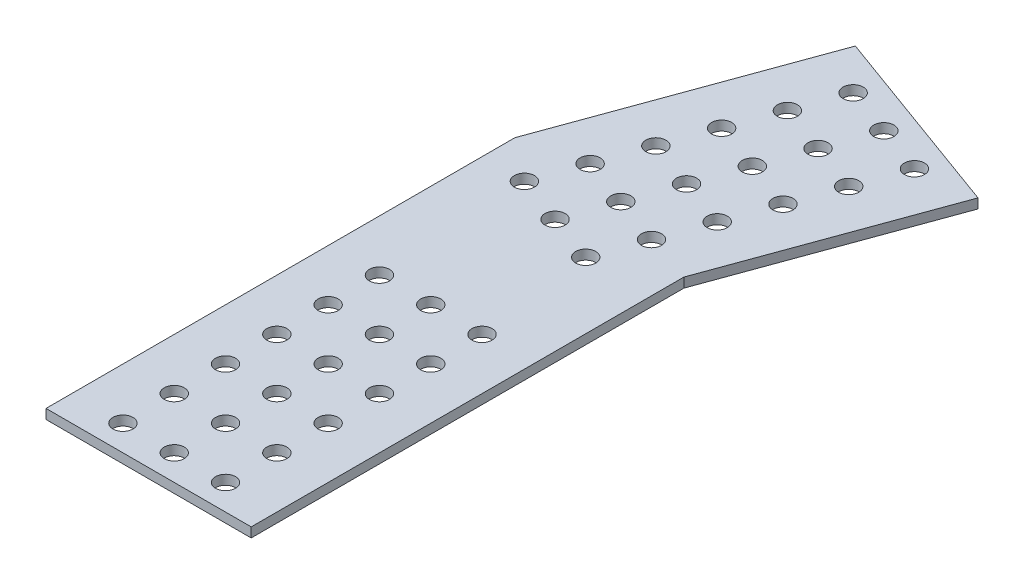
from build123d import *

# Parameters (mm, degrees)
SKETCH1_R           = 2.4892
BOSS_EXTRUDE1_DEPTH = 2.38125


with BuildPart() as part:
    # Sketch1 → Boss-Extrude1 (new body)
    with BuildSketch(Plane(origin=(0, 0, 0), x_dir=(1, 0, 0), z_dir=(0, 1, 0))):
        Polygon((-73.745518613, -384.005622456), (-73.745518613, -276.87877894), (-54.317612196, -223.501044752), (-102.053997332, -206.126421471), (-124.545518613, -267.92136832), (-124.545518613, -384.005622456), align=None)
        with Locations((-111.845518613, -377.655622456)):
            Circle(SKETCH1_R, mode=Mode.SUBTRACT)
        with Locations((-111.845518613, -364.955622456)):
            Circle(SKETCH1_R, mode=Mode.SUBTRACT)
        with Locations((-111.845518613, -352.255622456)):
            Circle(SKETCH1_R, mode=Mode.SUBTRACT)
        with Locations((-111.845518613, -339.555622456)):
            Circle(SKETCH1_R, mode=Mode.SUBTRACT)
        with Locations((-99.145518613, -377.655622456)):
            Circle(SKETCH1_R, mode=Mode.SUBTRACT)
        with Locations((-99.145518613, -364.955622456)):
            Circle(SKETCH1_R, mode=Mode.SUBTRACT)
        with Locations((-99.145518613, -352.255622456)):
            Circle(SKETCH1_R, mode=Mode.SUBTRACT)
        with Locations((-99.145518613, -339.555622456)):
            Circle(SKETCH1_R, mode=Mode.SUBTRACT)
        with Locations((-111.845518613, -326.855622456)):
            Circle(SKETCH1_R, mode=Mode.SUBTRACT)
        with Locations((-111.845518613, -314.155622456)):
            Circle(SKETCH1_R, mode=Mode.SUBTRACT)
        with Locations((-99.145518613, -326.855622456)):
            Circle(SKETCH1_R, mode=Mode.SUBTRACT)
        with Locations((-99.145518613, -314.155622456)):
            Circle(SKETCH1_R, mode=Mode.SUBTRACT)
        with Locations((-86.445518613, -377.655622456)):
            Circle(SKETCH1_R, mode=Mode.SUBTRACT)
        with Locations((-86.445518613, -364.955622456)):
            Circle(SKETCH1_R, mode=Mode.SUBTRACT)
        with Locations((-86.445518613, -352.255622456)):
            Circle(SKETCH1_R, mode=Mode.SUBTRACT)
        with Locations((-86.445518613, -339.555622456)):
            Circle(SKETCH1_R, mode=Mode.SUBTRACT)
        with Locations((-86.445518613, -326.855622456)):
            Circle(SKETCH1_R, mode=Mode.SUBTRACT)
        with Locations((-86.445518613, -314.155622456)):
            Circle(SKETCH1_R, mode=Mode.SUBTRACT)
        with Locations((-90.141815492, -284.794918494)):
            Circle(SKETCH1_R, mode=Mode.SUBTRACT)
        with Locations((-114.01000806, -276.107606853)):
            Circle(SKETCH1_R, mode=Mode.SUBTRACT)
        with Locations((-102.075911776, -280.451262674)):
            Circle(SKETCH1_R, mode=Mode.SUBTRACT)
        with Locations((-68.42353639, -225.124437074)):
            Circle(SKETCH1_R, mode=Mode.SUBTRACT)
        with Locations((-109.666352239, -264.173510569)):
            Circle(SKETCH1_R, mode=Mode.SUBTRACT)
        with Locations((-105.322696419, -252.239414285)):
            Circle(SKETCH1_R, mode=Mode.SUBTRACT)
        with Locations((-97.732255955, -268.51716639)):
            Circle(SKETCH1_R, mode=Mode.SUBTRACT)
        with Locations((-93.388600135, -256.583070106)):
            Circle(SKETCH1_R, mode=Mode.SUBTRACT)
        with Locations((-100.979040599, -240.305318001)):
            Circle(SKETCH1_R, mode=Mode.SUBTRACT)
        with Locations((-96.635384779, -228.371221717)):
            Circle(SKETCH1_R, mode=Mode.SUBTRACT)
        with Locations((-92.291728958, -216.437125433)):
            Circle(SKETCH1_R, mode=Mode.SUBTRACT)
        with Locations((-85.798159671, -272.86082221)):
            Circle(SKETCH1_R, mode=Mode.SUBTRACT)
        with Locations((-81.454503851, -260.926725926)):
            Circle(SKETCH1_R, mode=Mode.SUBTRACT)
        with Locations((-89.044944315, -244.648973822)):
            Circle(SKETCH1_R, mode=Mode.SUBTRACT)
        with Locations((-84.701288495, -232.714877538)):
            Circle(SKETCH1_R, mode=Mode.SUBTRACT)
        with Locations((-77.110848031, -248.992629642)):
            Circle(SKETCH1_R, mode=Mode.SUBTRACT)
        with Locations((-72.767192211, -237.058533358)):
            Circle(SKETCH1_R, mode=Mode.SUBTRACT)
        with Locations((-80.357632674, -220.780781254)):
            Circle(SKETCH1_R, mode=Mode.SUBTRACT)
    extrude(amount=BOSS_EXTRUDE1_DEPTH)


solid = part.part
